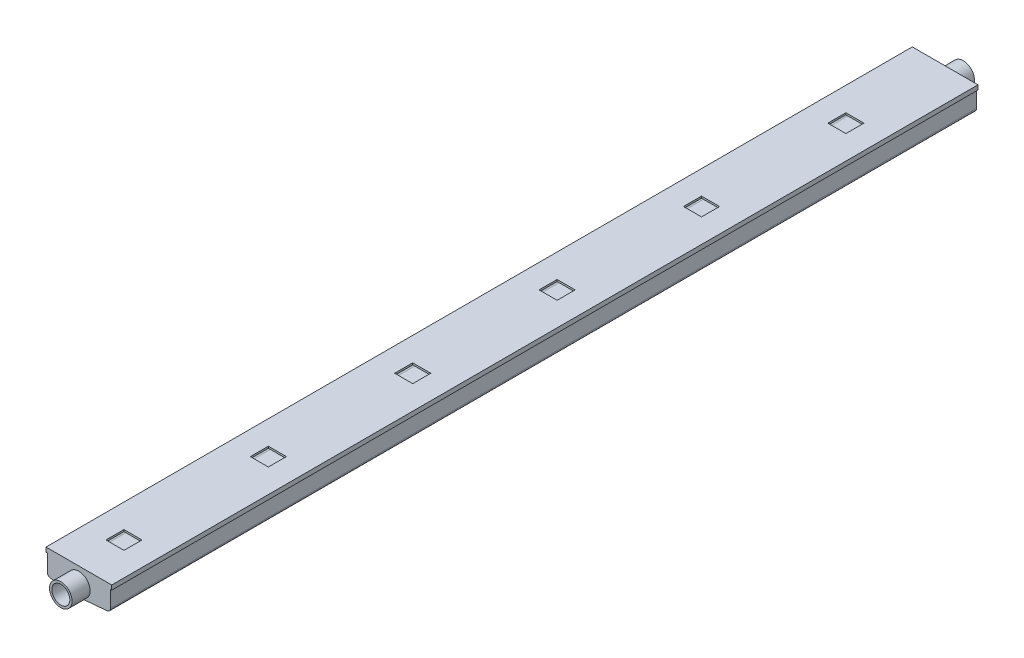
from build123d import *

# Parameters (mm, degrees)
BOSS_EXTRUDE1_DEPTH = 1219.2
SKETCH3_W           = 1219.2
SKETCH3_H           = 6.35
BOSS_EXTRUDE2_DEPTH = 1.778
SKETCH4_W           = 1219.2
SKETCH4_H           = 6.35
BOSS_EXTRUDE3_DEPTH = 1.778
FILLET1_R           = 5.08
SHELL1_START        = 2.54
SHELL1_DEPTH        = 1214.12
CUT_EXTRUDE1_REACH  = 1222.671
SKETCH6_W           = 25.4
SKETCH6_H           = 25.4
SKETCH7_R           = 15.875
SKETCH7_R_2         = 12.7
BOSS_EXTRUDE4_DEPTH = 25.4
CUT_EXTRUDE2_REACH  = 1222.256
SKETCH10_R          = 12.7
BOSS_EXTRUDE5_START = 25.4
SKETCH11_R          = 15.875
SKETCH11_R_2        = 12.7
BOSS_EXTRUDE5_DEPTH = 25.4
CUT_EXTRUDE3_REACH  = 1247.634
SKETCH12_R          = 12.7


# Read off the part's stored shape, not the designer's step: Shell1
with BuildPart() as part:
    # Sketch1 → Boss-Extrude1 (new body)
    with BuildSketch(Plane.XY):
        Polygon((-44.45, -17.145), (-44.45, 17.145), (44.45, 17.145), (44.45, -17.145), (0, -20.955), align=None)
    extrude(amount=BOSS_EXTRUDE1_DEPTH)

    # Sketch3 → Boss-Extrude2 (add)
    with BuildSketch(Plane.ZY.offset(44.45)):
        with Locations((609.6, 13.97)):
            Rectangle(SKETCH3_W, SKETCH3_H)
    extrude(amount=BOSS_EXTRUDE2_DEPTH)

    # Sketch4 → Boss-Extrude3 (add)
    with BuildSketch(Plane(origin=(44.45, 0, 0), x_dir=(0, 0, -1), z_dir=(1, 0, 0))):
        with Locations((-609.6, 13.97)):
            Rectangle(SKETCH4_W, SKETCH4_H)
    extrude(amount=BOSS_EXTRUDE3_DEPTH)

    # Fillet1
    fillet1_edges = [part.edges().sort_by_distance(p)[0] for p in [
        (44.45, -17.145, 609.6),
        (-44.45, -17.145, 609.6),
    ]]
    fillet(fillet1_edges, radius=FILLET1_R)

    # Shell1 outline → Shell1 (cut)
    with BuildSketch(Plane.XY.offset(SHELL1_START)):
        with BuildLine():
            Line((41.91, -12.481801497), (41.91, 13.335))
            Line((41.91, 13.335), (43.688, 13.335))
            Line((43.688, 13.335), (43.688, 14.605))
            Line((43.688, 14.605), (-43.688, 14.605))
            Line((-43.688, 14.605), (-43.688, 13.335))
            Line((-43.688, 13.335), (-41.91, 13.335))
            Line((-41.91, 13.335), (-41.91, -12.481801497))
            ThreePointArc((-41.91, -12.481801497), (-41.241172627, -14.199449016), (-39.586918899, -15.012521986))
            Line((-39.586918899, -15.012521986), (0, -18.405686463))
            Line((0, -18.405686463), (39.586918899, -15.012521986))
            ThreePointArc((39.586918899, -15.012521986), (41.241172627, -14.199449016), (41.91, -12.481801497))
        make_face()
    extrude(amount=SHELL1_DEPTH, mode=Mode.SUBTRACT)

    # Sketch6 → Cut-Extrude1 (cut, up to next)
    with BuildSketch(Plane(origin=(0, 17.145, 0), x_dir=(1, 0, 0), z_dir=(0, 1, 0)), mode=Mode.PRIVATE) as cut_extrude1_sk1:
        with Locations((0, -1155.7)):
            Rectangle(SKETCH6_W, SKETCH6_H)
    cut_extrude1_tool1 = extrude(cut_extrude1_sk1.sketch, amount=-CUT_EXTRUDE1_REACH, mode=Mode.PRIVATE) & part.part
    # Sketch6 → Cut-Extrude1 (cut, up to next)
    with BuildSketch(Plane(origin=(0, 17.145, 0), x_dir=(1, 0, 0), z_dir=(0, 1, 0)), mode=Mode.PRIVATE) as cut_extrude1_sk2:
        with Locations((0, -952.5)):
            Rectangle(SKETCH6_W, SKETCH6_H)
    cut_extrude1_tool2 = extrude(cut_extrude1_sk2.sketch, amount=-CUT_EXTRUDE1_REACH, mode=Mode.PRIVATE) & part.part
    # Sketch6 → Cut-Extrude1 (cut, up to next)
    with BuildSketch(Plane(origin=(0, 17.145, 0), x_dir=(1, 0, 0), z_dir=(0, 1, 0)), mode=Mode.PRIVATE) as cut_extrude1_sk3:
        with Locations((0, -749.3)):
            Rectangle(SKETCH6_W, SKETCH6_H)
    cut_extrude1_tool3 = extrude(cut_extrude1_sk3.sketch, amount=-CUT_EXTRUDE1_REACH, mode=Mode.PRIVATE) & part.part
    # Sketch6 → Cut-Extrude1 (cut, up to next)
    with BuildSketch(Plane(origin=(0, 17.145, 0), x_dir=(1, 0, 0), z_dir=(0, 1, 0)), mode=Mode.PRIVATE) as cut_extrude1_sk4:
        with Locations((0, -546.1)):
            Rectangle(SKETCH6_W, SKETCH6_H)
    cut_extrude1_tool4 = extrude(cut_extrude1_sk4.sketch, amount=-CUT_EXTRUDE1_REACH, mode=Mode.PRIVATE) & part.part
    # Sketch6 → Cut-Extrude1 (cut, up to next)
    with BuildSketch(Plane(origin=(0, 17.145, 0), x_dir=(1, 0, 0), z_dir=(0, 1, 0)), mode=Mode.PRIVATE) as cut_extrude1_sk5:
        with Locations((0, -342.9)):
            Rectangle(SKETCH6_W, SKETCH6_H)
    cut_extrude1_tool5 = extrude(cut_extrude1_sk5.sketch, amount=-CUT_EXTRUDE1_REACH, mode=Mode.PRIVATE) & part.part
    # Sketch6 → Cut-Extrude1 (cut, up to next)
    with BuildSketch(Plane(origin=(0, 17.145, 0), x_dir=(1, 0, 0), z_dir=(0, 1, 0)), mode=Mode.PRIVATE) as cut_extrude1_sk6:
        with Locations((0, -139.7)):
            Rectangle(SKETCH6_W, SKETCH6_H)
    cut_extrude1_tool6 = extrude(cut_extrude1_sk6.sketch, amount=-CUT_EXTRUDE1_REACH, mode=Mode.PRIVATE) & part.part
    add(cut_extrude1_tool1.solids().sort_by_distance((0, 17.145, 1155.7))[0], mode=Mode.SUBTRACT)
    add(cut_extrude1_tool2.solids().sort_by_distance((0, 17.145, 952.5))[0], mode=Mode.SUBTRACT)
    add(cut_extrude1_tool3.solids().sort_by_distance((0, 17.145, 749.3))[0], mode=Mode.SUBTRACT)
    add(cut_extrude1_tool4.solids().sort_by_distance((0, 17.145, 546.1))[0], mode=Mode.SUBTRACT)
    add(cut_extrude1_tool5.solids().sort_by_distance((0, 17.145, 342.9))[0], mode=Mode.SUBTRACT)
    add(cut_extrude1_tool6.solids().sort_by_distance((0, 17.145, 139.7))[0], mode=Mode.SUBTRACT)

    # Sketch7 → Boss-Extrude4 (add)
    with BuildSketch(Plane(origin=(0, 0, 0), x_dir=(-1, 0, 0), z_dir=(0, 0, -1))):
        with Locations(Location((0, -5.08, 0), (0, 0, 260.201815092))):
            Circle(SKETCH7_R)
        with Locations((0, -5.08)):
            Circle(SKETCH7_R_2, mode=Mode.SUBTRACT)
    extrude(amount=BOSS_EXTRUDE4_DEPTH)

    # Sketch10 → Cut-Extrude2 (cut, up to next)
    with BuildSketch(Plane(origin=(0, 0, 0), x_dir=(-1, 0, 0), z_dir=(0, 0, -1)), mode=Mode.PRIVATE) as cut_extrude2_sk1:
        with Locations((0, -5.08)):
            Circle(SKETCH10_R)
    cut_extrude2_tool1 = extrude(cut_extrude2_sk1.sketch, amount=-CUT_EXTRUDE2_REACH, mode=Mode.PRIVATE) & part.part
    add(cut_extrude2_tool1.solids().sort_by_distance((0, -5.08, 0))[0], mode=Mode.SUBTRACT)

    # Sketch11 → Boss-Extrude5 (add)
    with BuildSketch(Plane.XY.offset(1219.2).offset(BOSS_EXTRUDE5_START)):
        with Locations(Location((0, -5.08, 0), (0, 0, 279.798184908))):
            Circle(SKETCH11_R)
        with Locations(Location((0, -5.08, 0), (0, 0, 180))):
            Circle(SKETCH11_R_2, mode=Mode.SUBTRACT)
    extrude(amount=-BOSS_EXTRUDE5_DEPTH)

    # Sketch12 → Cut-Extrude3 (cut, up to next)
    with BuildSketch(Plane.XY.offset(1219.2), mode=Mode.PRIVATE) as cut_extrude3_sk1:
        with Locations(Location((0, -5.08, 0), (0, 0, 180))):
            Circle(SKETCH12_R)
    cut_extrude3_tool1 = extrude(cut_extrude3_sk1.sketch, amount=-CUT_EXTRUDE3_REACH, mode=Mode.PRIVATE) & part.part
    add(cut_extrude3_tool1.solids().sort_by_distance((0, -5.08, 1219.2))[0], mode=Mode.SUBTRACT)


solid = part.part
